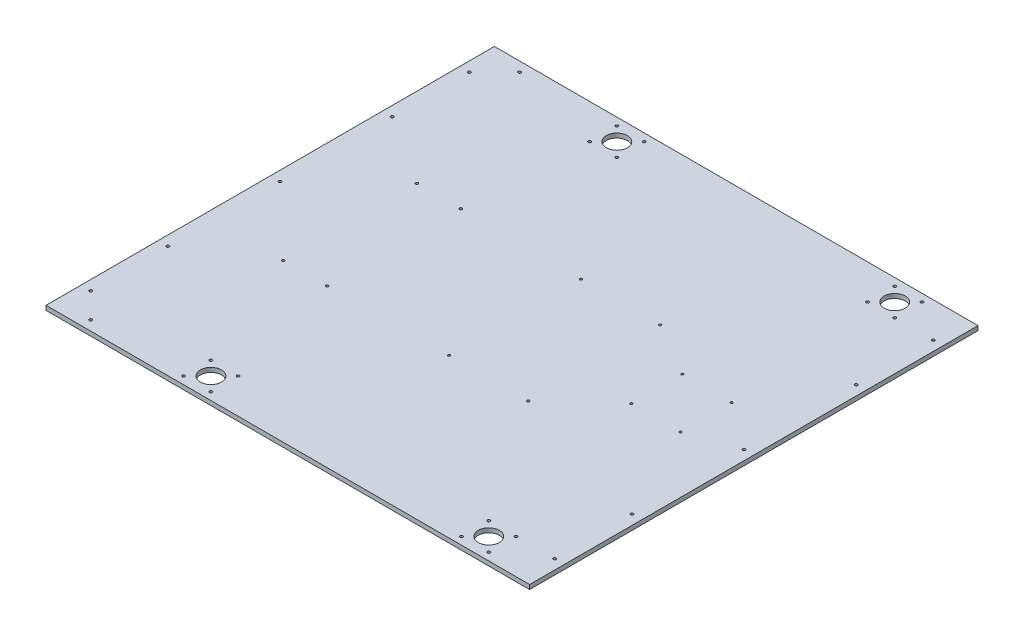
from build123d import *

# Parameters (mm, degrees)
SKETCH1_W                              = 510
SKETCH1_H                              = 5
BOSS_EXTRUDE1_DEPTH                    = 550
BOTTHOMHOLES_SKETCH2_R                 = 12
BOTTHOMHOLES_SKETCH2_R_2               = 1.5875
BOTTOMHOLES_CUT_EXTRUDE1_DEPTH         = 751.083328704
BOTTOMPSUHOLESSKETCH2_R                = 1.5
BOTTOMPSUHOLESCUT_EXTRUDE1_DEPTH       = 751.083328704
BOTTOMMAINBOARDHOLESSKETCH2_R          = 1.35
BOTTOMMAINBOARDHOLESCUT_EXTRUDE1_DEPTH = 751.083328704


with BuildPart() as part:
    # Sketch1 → Boss-Extrude1 (new body)
    with BuildSketch(Plane(origin=(0, 0, 0), x_dir=(0, 0, -1), z_dir=(1, 0, 0))):
        with Locations((-255, 2.5)):
            Rectangle(SKETCH1_W, SKETCH1_H)
    extrude(amount=BOSS_EXTRUDE1_DEPTH)

    # BotthomHoles-Sketch2 → BottomHoles-Cut-Extrude1 (cut, through all)
    with BuildSketch(Plane(origin=(0, 5, 0), x_dir=(1, 0, 0), z_dir=(0, 1, 0))):
        with Locations((479.425, -24.175)):
            Circle(BOTTHOMHOLES_SKETCH2_R)
        with Locations((463.925, -8.675)):
            Circle(BOTTHOMHOLES_SKETCH2_R_2)
        with Locations((494.925, -8.675)):
            Circle(BOTTHOMHOLES_SKETCH2_R_2)
        with Locations((463.925, -39.675)):
            Circle(BOTTHOMHOLES_SKETCH2_R_2)
        with Locations((494.925, -39.675)):
            Circle(BOTTHOMHOLES_SKETCH2_R_2)
        with Locations((39.6875, -11.1125)):
            Circle(BOTTHOMHOLES_SKETCH2_R_2)
        with Locations((178.925, -39.675)):
            Circle(BOTTHOMHOLES_SKETCH2_R_2)
        with Locations((147.925, -39.675)):
            Circle(BOTTHOMHOLES_SKETCH2_R_2)
        with Locations((178.925, -8.675)):
            Circle(BOTTHOMHOLES_SKETCH2_R_2)
        with Locations((147.925, -8.675)):
            Circle(BOTTHOMHOLES_SKETCH2_R_2)
        with Locations((163.425, -24.175)):
            Circle(BOTTHOMHOLES_SKETCH2_R)
        with Locations((39.6875, -498.8875)):
            Circle(BOTTHOMHOLES_SKETCH2_R_2)
        with Locations((147.925, -501.325)):
            Circle(BOTTHOMHOLES_SKETCH2_R_2)
        with Locations((178.925, -501.325)):
            Circle(BOTTHOMHOLES_SKETCH2_R_2)
        with Locations((147.925, -470.325)):
            Circle(BOTTHOMHOLES_SKETCH2_R_2)
        with Locations((178.925, -470.325)):
            Circle(BOTTHOMHOLES_SKETCH2_R_2)
        with Locations((463.925, -470.325)):
            Circle(BOTTHOMHOLES_SKETCH2_R_2)
        with Locations((463.925, -501.325)):
            Circle(BOTTHOMHOLES_SKETCH2_R_2)
        with Locations((494.925, -470.325)):
            Circle(BOTTHOMHOLES_SKETCH2_R_2)
        with Locations((494.925, -501.325)):
            Circle(BOTTHOMHOLES_SKETCH2_R_2)
        with Locations((163.425, -485.825)):
            Circle(BOTTHOMHOLES_SKETCH2_R)
        with Locations((479.425, -485.825)):
            Circle(BOTTHOMHOLES_SKETCH2_R)
        with Locations((11.1125, -39.6875)):
            Circle(BOTTHOMHOLES_SKETCH2_R_2)
        with Locations((11.1125, -127.5)):
            Circle(BOTTHOMHOLES_SKETCH2_R_2)
        with Locations((11.1125, -255)):
            Circle(BOTTHOMHOLES_SKETCH2_R_2)
        with Locations((11.1125, -382.5)):
            Circle(BOTTHOMHOLES_SKETCH2_R_2)
        with Locations((11.1125, -470.3125)):
            Circle(BOTTHOMHOLES_SKETCH2_R_2)
        with Locations((538.8875, -470.3125)):
            Circle(BOTTHOMHOLES_SKETCH2_R_2)
        with Locations((538.8875, -382.5)):
            Circle(BOTTHOMHOLES_SKETCH2_R_2)
        with Locations((538.8875, -255)):
            Circle(BOTTHOMHOLES_SKETCH2_R_2)
        with Locations((538.8875, -127.5)):
            Circle(BOTTHOMHOLES_SKETCH2_R_2)
        with Locations((538.8875, -39.6875)):
            Circle(BOTTHOMHOLES_SKETCH2_R_2)
    extrude(amount=-BOTTOMHOLES_CUT_EXTRUDE1_DEPTH, mode=Mode.SUBTRACT)

    # BottomPSUHolesSketch2 → BottomPSUHolesCut-Extrude1 (cut, through all)
    with BuildSketch(Plane(origin=(0, 5, 0), x_dir=(1, 0, 0), z_dir=(0, 1, 0))):
        with Locations((90.8, -179)):
            Circle(BOTTOMPSUHOLESSKETCH2_R)
        with Locations((140.8, -179)):
            Circle(BOTTOMPSUHOLESSKETCH2_R)
        with Locations((90.8, -331)):
            Circle(BOTTOMPSUHOLESSKETCH2_R)
        with Locations((140.8, -331)):
            Circle(BOTTOMPSUHOLESSKETCH2_R)
    extrude(amount=-BOTTOMPSUHOLESCUT_EXTRUDE1_DEPTH, mode=Mode.SUBTRACT)

    # BottomMainboardHolesSketch2 → BottomMainboardHolesCut-Extrude1 (cut, through all)
    with BuildSketch(Plane(origin=(0, 5, 0), x_dir=(1, 0, 0), z_dir=(0, 1, 0))):
        with Locations((278.5, -180)):
            Circle(BOTTOMMAINBOARDHOLESSKETCH2_R)
        with Locations((368.5, -180)):
            Circle(BOTTOMMAINBOARDHOLESSKETCH2_R)
        with Locations((278.5, -330)):
            Circle(BOTTOMMAINBOARDHOLESSKETCH2_R)
        with Locations((368.5, -330)):
            Circle(BOTTOMMAINBOARDHOLESSKETCH2_R)
        with Locations((429.7, -216)):
            Circle(BOTTOMMAINBOARDHOLESSKETCH2_R)
        with Locations((485.7, -216)):
            Circle(BOTTOMMAINBOARDHOLESSKETCH2_R)
        with Locations((429.7, -274)):
            Circle(BOTTOMMAINBOARDHOLESSKETCH2_R)
        with Locations((485.7, -274)):
            Circle(BOTTOMMAINBOARDHOLESSKETCH2_R)
    extrude(amount=-BOTTOMMAINBOARDHOLESCUT_EXTRUDE1_DEPTH, mode=Mode.SUBTRACT)


solid = part.part
